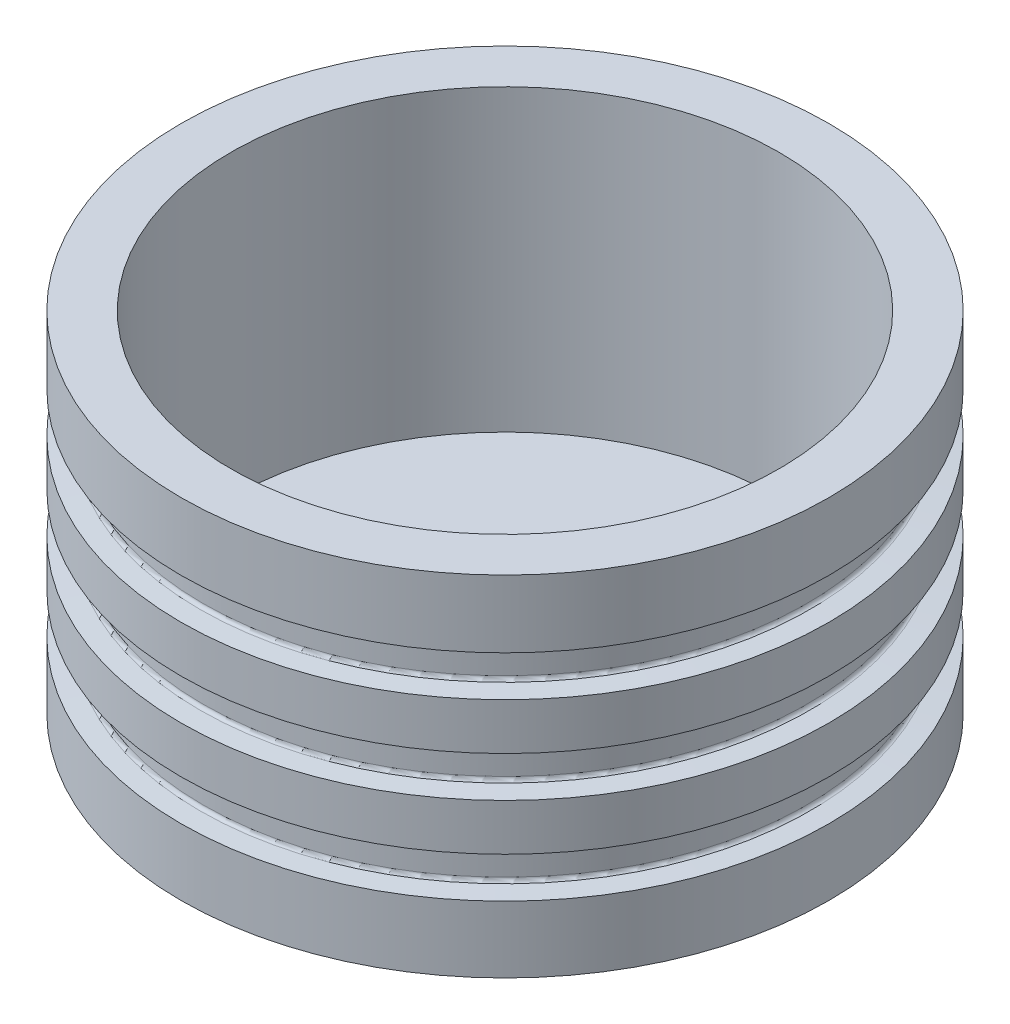
from build123d import *


with BuildPart() as part:
    # Sketch1 → Revolve1 (revolve)
    with BuildSketch(Plane.XY):
        Polygon((-41.275, 0), (-41.275, 44.45), (-34.925, 44.45), (-34.925, 6.35), (-1.91325754, 6.35), (-1.91325754, 0), (-1.91325754, -12.7), (-6.35, -12.7), (-6.35, 0), align=None)
    revolve(axis=Axis((0, 0, 0), (0, 1, 0)))

    # Sketch5 → Groove for AS 568-234, O-Ring1 (revolve, cut)
    with BuildSketch(Plane(origin=(0, 0, 0), x_dir=(0, 0, -1), z_dir=(-1, 0, 0))):
        with BuildLine():
            Line((38.861359272, -30.908756056), (41.3639, -30.689812113))
            Line((41.3639, -30.689812113), (41.3639, -35.8775))
            Line((41.3639, -35.8775), (38.861359272, -35.658556056))
            ThreePointArc((38.861359272, -35.658556056), (38.572380224, -35.51604736), (38.4556, -35.215747513))
            Line((38.4556, -35.215747513), (38.4556, -31.3515646))
            ThreePointArc((38.4556, -31.3515646), (38.572380224, -31.051264752), (38.861359272, -30.908756056))
        make_face()
    revolve(axis=Axis((0, -50, 0), (0, 1, 0)), mode=Mode.SUBTRACT)

    # Sketch7 → Groove for AS 568-234, O-Ring2 (revolve, cut)
    with BuildSketch(Plane(origin=(0, 0, 0), x_dir=(0, 0, -1), z_dir=(-1, 0, 0))):
        with BuildLine():
            Line((38.861359272, -19.796256056), (41.3639, -19.577312113))
            Line((41.3639, -19.577312113), (41.3639, -24.765))
            Line((41.3639, -24.765), (38.861359272, -24.546056056))
            ThreePointArc((38.861359272, -24.546056056), (38.572380224, -24.40354736), (38.4556, -24.103247513))
            Line((38.4556, -24.103247513), (38.4556, -20.2390646))
            ThreePointArc((38.4556, -20.2390646), (38.572380224, -19.938764752), (38.861359272, -19.796256056))
        make_face()
    revolve(axis=Axis((0, -50, 0), (0, 1, 0)), mode=Mode.SUBTRACT)

    # Sketch9 → Groove for AS 568-234, O-Ring3 (revolve, cut)
    with BuildSketch(Plane(origin=(0, 0, 0), x_dir=(0, 0, -1), z_dir=(-1, 0, 0))):
        with BuildLine():
            Line((38.861359272, -8.683756056), (41.3639, -8.464812113))
            Line((41.3639, -8.464812113), (41.3639, -13.6525))
            Line((41.3639, -13.6525), (38.861359272, -13.433556056))
            ThreePointArc((38.861359272, -13.433556056), (38.572380224, -13.29104736), (38.4556, -12.990747513))
            Line((38.4556, -12.990747513), (38.4556, -9.1265646))
            ThreePointArc((38.4556, -9.1265646), (38.572380224, -8.826264752), (38.861359272, -8.683756056))
        make_face()
    revolve(axis=Axis((0, -50, 0), (0, 1, 0)), mode=Mode.SUBTRACT)


solid = part.part
